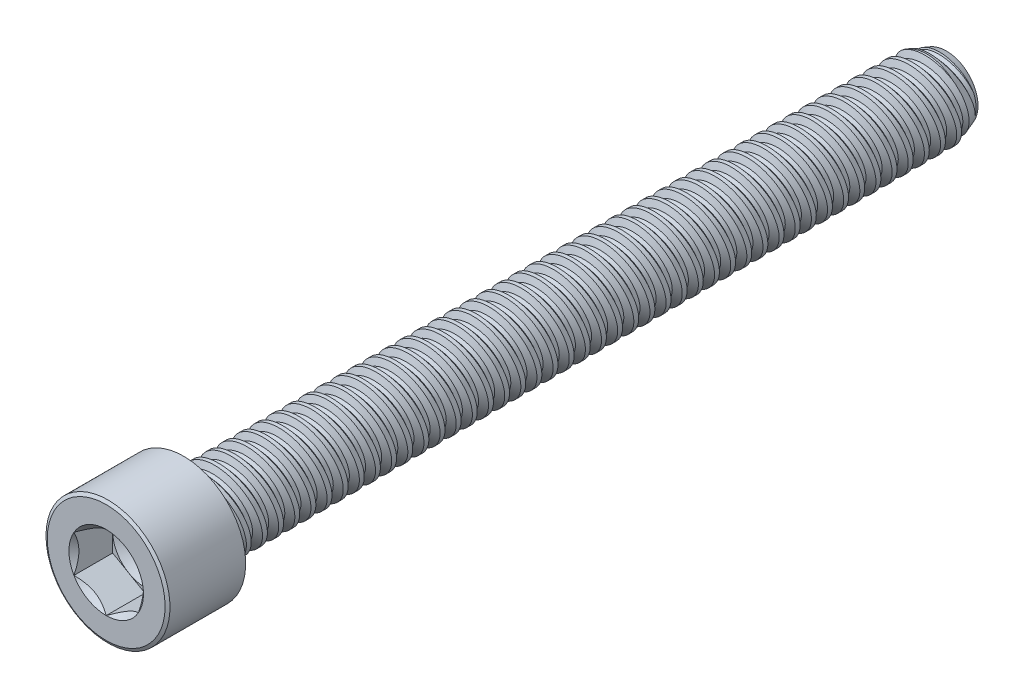
from build123d import *

# Parameters (mm, degrees)
SKETCH1_W          = 15
SKETCH1_H          = 0.762
LPATTERN1_COUNT    = 47
LPATTERN1_PITCH    = 0.3175
LPATTERN2_COUNT    = 2
LPATTERN2_PITCH    = 0.3175
SKETCH4_R          = 1.2192
EXTRUDE1_DEPTH     = 1.524
CHAMFER1_SIZE      = 0.06096
CHAMFER1_SIZE2     = 0.035195272
CUT_EXTRUDE1_DEPTH = 0.762
SKETCH8_R          = 0.635
CUT_EXTRUDE5_DEPTH = 0.254
CUT_EXTRUDE5_DRAFT = -60


with BuildPart() as part:
    # Sketch1 → Revolve1 (revolve)
    with BuildSketch(Plane(origin=(0, 0, 0), x_dir=(0, 0, -1), z_dir=(1, 0, 0))):
        with Locations((7.5, 0.381)):
            Rectangle(SKETCH1_W, SKETCH1_H)
    revolve(axis=Axis((0, 0, 0), (0, 0, 1)))

    # Sketch2 → Cut-Revolve1 (revolve, cut)
    with BuildSketch(Plane(origin=(0, 0, 0), x_dir=(0, 0, -1), z_dir=(1, 0, 0))):
        Polygon((0.038853285, 0.770094434), (0.310826283, 0.826755476), (0.248742999, 0.638279729), (0.171036428, 0.62209086), align=None)
    cut_revolve1 = revolve(axis=Axis((0, -0.071078816, 0), (0, 0.2039542541120012, -0.978980419737605)), mode=Mode.SUBTRACT)

    # Sketch3 → Cut-Revolve2 (revolve, cut)
    with BuildSketch(Plane(origin=(0, 0, 0), x_dir=(0, 0, -1), z_dir=(1, 0, 0))):
        Polygon((15, 0.62209086), (14.615602796, 0.762), (15, 0.762), align=None)
    revolve(axis=Axis((0, 0, -14.615602796), (0, 0, 1)), mode=Mode.SUBTRACT)

    # LPattern1: Cut-Revolve1 ×47
    with Locations(*[(0, 0, -i * LPATTERN1_PITCH) for i in range(1, LPATTERN1_COUNT)]):
        add(cut_revolve1, mode=Mode.SUBTRACT)

    # LPattern2: Cut-Revolve1 ×2
    with Locations(*[(0, 0, i * LPATTERN2_PITCH) for i in range(1, LPATTERN2_COUNT)]):
        add(cut_revolve1, mode=Mode.SUBTRACT)

    # Sketch4 → Extrude1 (add)
    with BuildSketch(Plane.XY):
        Circle(SKETCH4_R)
    extrude(amount=EXTRUDE1_DEPTH)

    # Chamfer1
    chamfer1_edges = [part.edges().sort_by_distance(p)[0] for p in [
        (-1.2192, 0, 1.524),
    ]]
    chamfer1_side = [part.faces().sort_by_distance(p)[0] for p in [
        (0, 0, 1.524),
    ]]
    chamfer(chamfer1_edges, length=CHAMFER1_SIZE, length2=CHAMFER1_SIZE2, reference=chamfer1_side[0])

    # Sketch6 → Cut-Extrude1 (cut)
    with BuildSketch(Plane.XY.offset(1.524)):
        Polygon((0, -0.733234842), (0.635, -0.366617421), (0.635, 0.366617421), (0, 0.733234842), (-0.635, 0.366617421), (-0.635, -0.366617421), align=None)
    extrude(amount=-CUT_EXTRUDE1_DEPTH, mode=Mode.SUBTRACT)

    # Cut-Extrude4 cone 1 section (through the dimple's axis) → Cut-Extrude4 (revolve, cut)
    with BuildSketch(Plane(origin=(0, 0, 1.524), x_dir=(0, -1, 0), z_dir=(1, 0, 0))):
        Polygon((0, 0), (0.733234842, 0), (0, 0.733234842), align=None)
    revolve(axis=Axis((0, 0, 1.524), (0, 0, -1)), mode=Mode.SUBTRACT)


with BuildPart() as cut_extrude5_tool:
    # Sketch8 → Cut-Extrude5 (with draft: the straight prism first)
    with BuildSketch(Plane.XY.offset(0.762)):
        Circle(SKETCH8_R)
    extrude(amount=-CUT_EXTRUDE5_DEPTH)
    # Cut-Extrude5: the draft: its side faces are tilted about the plane it starts from
    cut_extrude5_sides = [cut_extrude5_tool.faces().sort_by_distance(p)[0] for p in [
        (-0.635, 0, 0.635),
    ]]
    draft(cut_extrude5_sides, Plane.XY.offset(0.762), CUT_EXTRUDE5_DRAFT)


with BuildPart() as part_1:
    add(part.part)

    # Cut-Extrude5: cut by cut_extrude5_tool
    add(cut_extrude5_tool.part, mode=Mode.SUBTRACT)


solid = part_1.part
